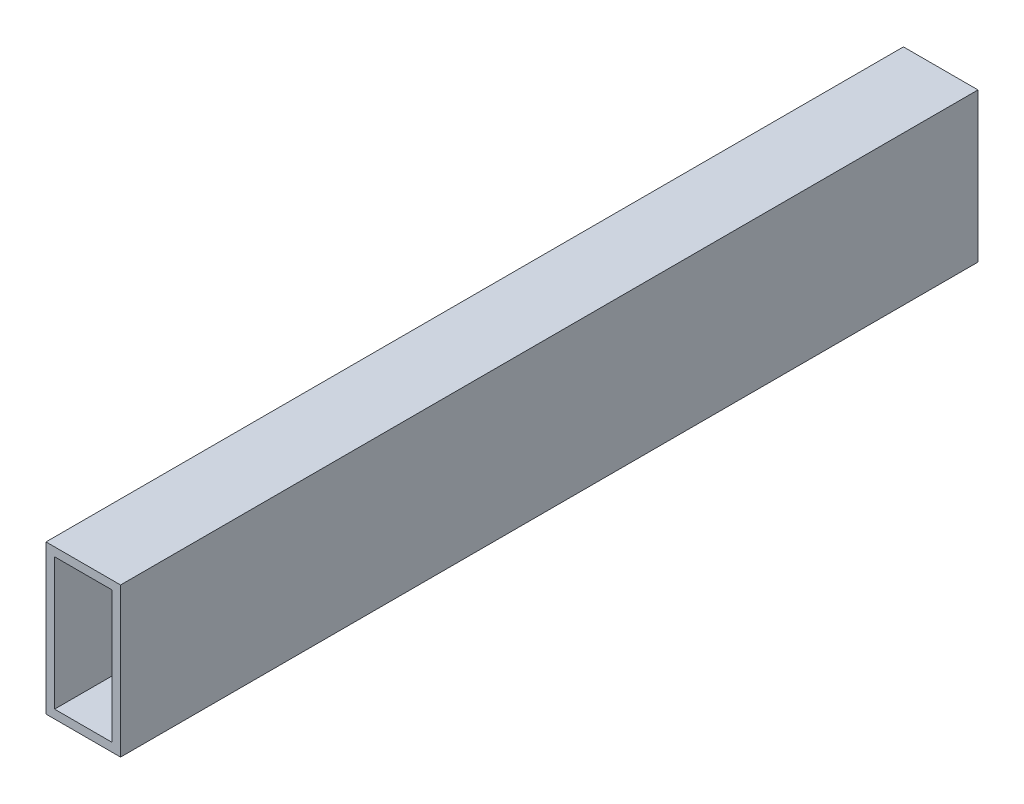
from build123d import *

# Parameters (mm, degrees)
SKETCH1_W           = 25.4
SKETCH1_H           = 50.8
SKETCH1_W_2         = 19.558
SKETCH1_H_2         = 44.958
BOSS_EXTRUDE1_DEPTH = 292.1


with BuildPart() as part:
    # Sketch1 → Boss-Extrude1 (new body)
    with BuildSketch(Plane.XY):
        Rectangle(SKETCH1_W, SKETCH1_H)
        Rectangle(SKETCH1_W_2, SKETCH1_H_2, mode=Mode.SUBTRACT)
    extrude(amount=BOSS_EXTRUDE1_DEPTH)


solid = part.part
